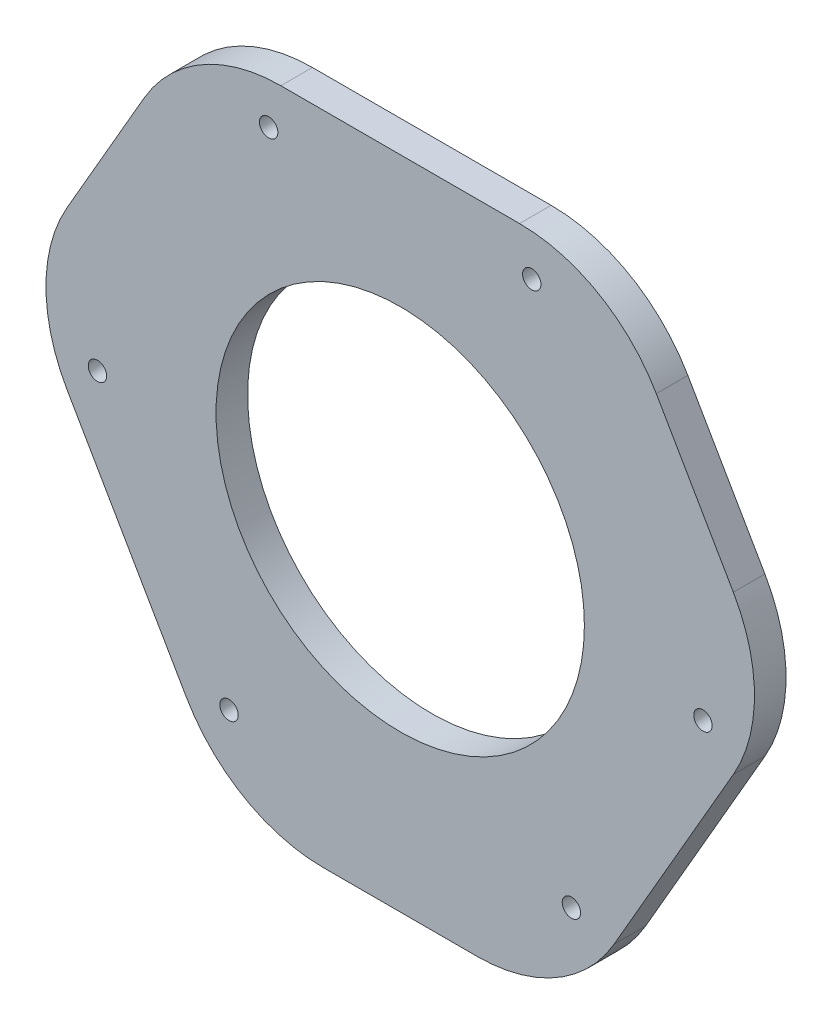
from build123d import *

# Parameters (mm, degrees)
SKETCH5_R           = 35
SKETCH5_R_2         = 1.75
BOSS_EXTRUDE2_DEPTH = 6
FILLET1_R           = 30
CIRPATTERN3_DEPTH   = 6


# Read off the part's stored shape, not the designer's step: CirPattern3
with BuildPart() as part:
    # Sketch5 → Boss-Extrude2 (new body)
    with BuildSketch(Plane.XY):
        Polygon((-40, 60), (40, 60), (71.961524227, 4.641016151), (31.961524227, -64.641016151), (-31.961524227, -64.641016151), (-71.961524227, 4.641016151), align=None)
        Circle(SKETCH5_R, mode=Mode.SUBTRACT)
        with Locations((-25, 52)):
            Circle(SKETCH5_R_2, mode=Mode.SUBTRACT)
        with Locations((25, 52)):
            Circle(SKETCH5_R_2, mode=Mode.SUBTRACT)
        with Locations((57.533320997, -4.349364905)):
            Circle(SKETCH5_R_2, mode=Mode.SUBTRACT)
        with Locations((32.533320997, -47.650635095)):
            Circle(SKETCH5_R_2, mode=Mode.SUBTRACT)
        with Locations((-32.533320997, -47.650635095)):
            Circle(SKETCH5_R_2, mode=Mode.SUBTRACT)
        with Locations((-57.533320997, -4.349364905)):
            Circle(SKETCH5_R_2, mode=Mode.SUBTRACT)
    extrude(amount=BOSS_EXTRUDE2_DEPTH)

    # Fillet1
    fillet1_edges = [part.edges().sort_by_distance(p)[0] for p in [
        (-40, 60, 3),
        (40, 60, 3),
    ]]
    fillet(fillet1_edges, radius=FILLET1_R)

    # CirPattern3 outline → CirPattern3 (cut)
    with BuildSketch(Plane.XY):
        with BuildLine():
            Line((-71.961524227, 4.641016151), (-63.301270189, -10.358983849))
            ThreePointArc((-63.301270189, -10.358983849), (-67.320508076, 4.641016151), (-63.301270189, 19.641016151))
            Line((-63.301270189, 19.641016151), (-71.961524227, 4.641016151))
        make_face()
        with BuildLine():
            Line((-31.961524227, -64.641016151), (-14.641016151, -64.641016151))
            ThreePointArc((-14.641016151, -64.641016151), (-29.641016151, -60.621778265), (-40.621778265, -49.641016151))
            Line((-40.621778265, -49.641016151), (-31.961524227, -64.641016151))
        make_face()
        with BuildLine():
            Line((31.961524227, -64.641016151), (40.621778265, -49.641016151))
            ThreePointArc((40.621778265, -49.641016151), (29.641016151, -60.621778265), (14.641016151, -64.641016151))
            Line((14.641016151, -64.641016151), (31.961524227, -64.641016151))
        make_face()
        with BuildLine():
            ThreePointArc((63.301270189, 19.641016151), (67.320508076, 4.641016151), (63.301270189, -10.358983849))
            Line((63.301270189, -10.358983849), (71.961524227, 4.641016151))
            Line((71.961524227, 4.641016151), (63.301270189, 19.641016151))
        make_face()
    extrude(amount=CIRPATTERN3_DEPTH, mode=Mode.SUBTRACT)


solid = part.part
